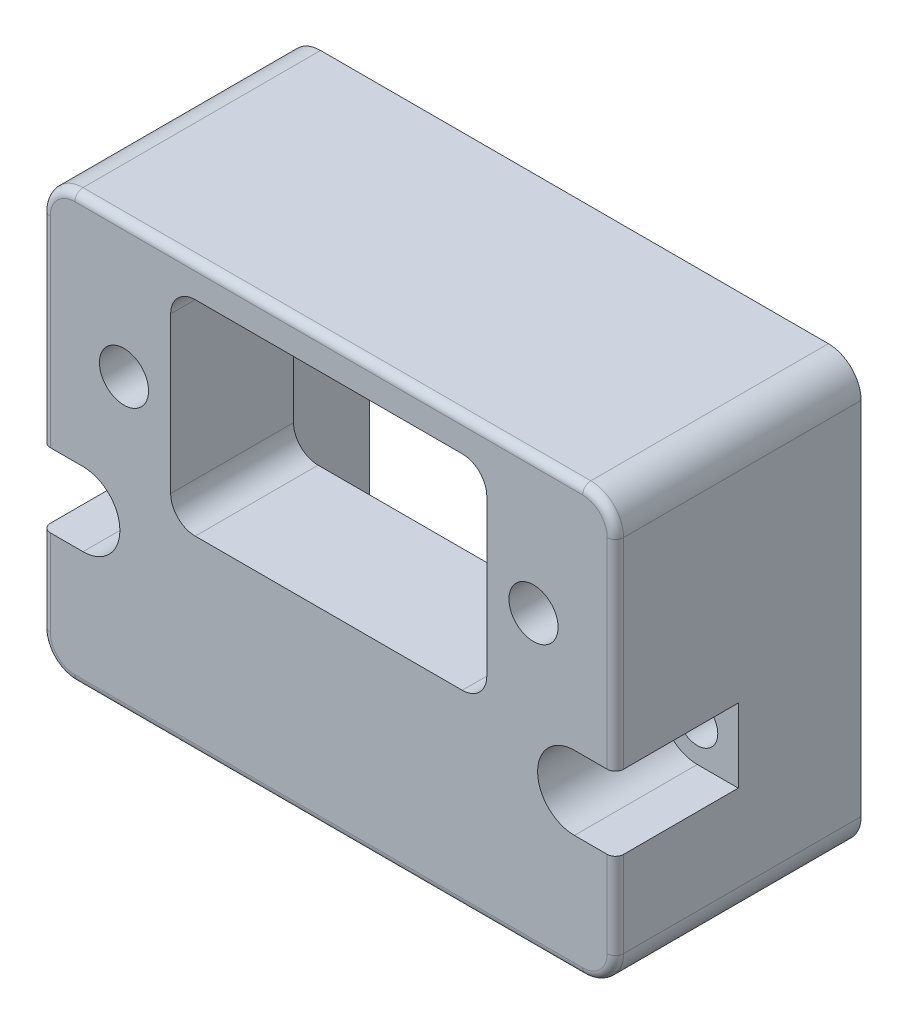
from build123d import *

# Parameters (mm, degrees)
SKETCH_1_W          = 35
SKETCH_1_H          = 26
SKETCH_1_R          = 1.25
EXTRUDE_1_DEPTH     = 15
CUT_EXTRUDE_1_DEPTH = 7.5
FILLET_1_R          = 1.5
FILLET_2_R          = 0.5
CUT_EXTRUDE_START   = -10
SKETCH_8_R          = 1.5
CUT_EXTRUDE_5_DEPTH = 10
CUT_EXTRUDE_6_DEPTH = 7.5
FILLET_3_R          = 2
SKETCH_10_R         = 4
CUT_EXTRUDE_7_DEPTH = 7.5


with BuildPart() as part:
    # Эскиз1 → Вытянуть1 (new body)
    with BuildSketch(Plane.XY):
        with Locations((17.5, 13)):
            Rectangle(SKETCH_1_W, SKETCH_1_H)
        with Locations((2.5, 9.5)):
            Circle(SKETCH_1_R, mode=Mode.SUBTRACT)
        with Locations((32.5, 9.5)):
            Circle(SKETCH_1_R, mode=Mode.SUBTRACT)
    extrude(amount=EXTRUDE_1_DEPTH)

    # Эскиз2 → Вырез-Вытянуть1 (cut)
    with BuildSketch(Plane(origin=(0, 0, 0), x_dir=(-1, 0, 0), z_dir=(0, 0, -1))):
        with BuildLine():
            Line((-30, 2), (-5, 2))
            Line((-5, 2), (-5, 16.25))
            ThreePointArc((-5, 16.25), (-3.5, 17.75), (-5, 19.25))
            Line((-5, 19.25), (-5, 24))
            Line((-5, 24), (-30, 24))
            Line((-30, 24), (-30, 19.25))
            ThreePointArc((-30, 19.25), (-31.5, 17.75), (-30, 16.25))
            Line((-30, 16.25), (-30, 2))
        make_face()
    extrude(amount=-CUT_EXTRUDE_1_DEPTH, mode=Mode.SUBTRACT)

    # Скругление1
    fillet_1_edges = [part.edges().sort_by_distance(p)[0] for p in [
        (30, 24, 3.75),
        (5, 24, 3.75),
        (5, 2, 3.75),
        (30, 2, 3.75),
    ]]
    fillet(fillet_1_edges, radius=FILLET_1_R)

    # Скругление2
    fillet_2_edges = [part.edges().sort_by_distance(p)[0] for p in [
        (17.5, 0, 15),
        (0, 13, 15),
        (35, 13, 15),
        (17.5, 26, 15),
    ]]
    fillet(fillet_2_edges, radius=FILLET_2_R)

    # Эскиз8 → Вырез-Вытянуть5 (cut)
    with BuildSketch(Plane.XY.offset(15).offset(CUT_EXTRUDE_START)):
        with Locations(Location((5, 17.75, 0), (0, 0, 180))):
            Circle(SKETCH_8_R)
        with Locations(Location((30, 17.75, 0), (0, 0, 180))):
            Circle(SKETCH_8_R)
        with BuildLine():
            Line((9.35, 11.5), (25.65, 11.5))
            ThreePointArc((25.65, 11.5), (26.710660172, 11.939339828), (27.15, 13))
            Line((27.15, 13), (27.15, 22.5))
            ThreePointArc((27.15, 22.5), (26.710660172, 23.560660172), (25.65, 24))
            Line((25.65, 24), (9.35, 24))
            ThreePointArc((9.35, 24), (8.289339828, 23.560660172), (7.85, 22.5))
            Line((7.85, 22.5), (7.85, 13))
            ThreePointArc((7.85, 13), (8.289339828, 11.939339828), (9.35, 11.5))
        make_face()
    extrude(amount=CUT_EXTRUDE_5_DEPTH, mode=Mode.SUBTRACT)

    # Эскиз9 → Вырез-Вытянуть6 (cut)
    with BuildSketch(Plane.XY.offset(15)):
        with BuildLine():
            Line((2.5, 7.25), (-1.280678269, 7.25))
            Line((-1.280678269, 7.25), (-1.280678269, 11.75))
            Line((-1.280678269, 11.75), (2.5, 11.75))
            ThreePointArc((2.5, 11.75), (4.75, 9.5), (2.5, 7.25))
        make_face()
        with BuildLine():
            Line((32.5, 7.25), (36.280678269, 7.25))
            Line((36.280678269, 7.25), (36.280678269, 11.75))
            Line((36.280678269, 11.75), (32.5, 11.75))
            ThreePointArc((32.5, 11.75), (30.25, 9.5), (32.5, 7.25))
        make_face()
    extrude(amount=-CUT_EXTRUDE_6_DEPTH, mode=Mode.SUBTRACT)

    # Скругление3
    # the kernel refuses this fillet: 2 mm, written as the material it takes off along each edge
    with BuildSketch(Plane(origin=(33, 24, 15), x_dir=(1, 0, 0), z_dir=(0, -1, 0))) as fillet_3_piece_1:
        with BuildLine():
            CenterArc((1.5, -0.5), 0.5, 0, 90)
            Line((2, -0.5), (2, 0))
            Line((2, 0), (1.5, 0))
        make_face()
    revolve(axis=Axis((33, 24, 15), (0, 0, 1)), revolution_arc=90, mode=Mode.SUBTRACT)
    with BuildSketch(Plane(origin=(2, 24, 15), x_dir=(0, 1, 0), z_dir=(1, 0, 0))) as fillet_3_piece_2:
        with BuildLine():
            CenterArc((1.5, -0.5), 0.5, 0, 90)
            Line((2, -0.5), (2, 0))
            Line((2, 0), (1.5, 0))
        make_face()
    revolve(axis=Axis((2, 24, 15), (0, 0, 1)), revolution_arc=90, mode=Mode.SUBTRACT)
    with BuildSketch(Plane(origin=(33, 2, 15), x_dir=(0, -1, 0), z_dir=(-1, 0, 0))) as fillet_3_piece_3:
        with BuildLine():
            CenterArc((1.5, -0.5), 0.5, 0, 90)
            Line((2, -0.5), (2, 0))
            Line((2, 0), (1.5, 0))
        make_face()
    revolve(axis=Axis((33, 2, 15), (0, 0, 1)), revolution_arc=90, mode=Mode.SUBTRACT)
    with BuildSketch(Plane(origin=(2, 2, 15), x_dir=(-1, 0, 0), z_dir=(0, 1, 0))) as fillet_3_piece_4:
        with BuildLine():
            CenterArc((1.5, -0.5), 0.5, 0, 90)
            Line((2, -0.5), (2, 0))
            Line((2, 0), (1.5, 0))
        make_face()
    revolve(axis=Axis((2, 2, 15), (0, 0, 1)), revolution_arc=90, mode=Mode.SUBTRACT)
    with BuildSketch(Plane(origin=(0, 0, -5), x_dir=(1, 0, 0), z_dir=(0, 0, 1)), Plane(origin=(0, 26, -5), x_dir=(0, -1, 0), z_dir=(0, 0, 1))) as fillet_3_piece_5:
        with BuildLine():
            CenterArc((FILLET_3_R, FILLET_3_R), FILLET_3_R, 180, 90)
            Line((0, FILLET_3_R), (0, 0))
            Line((0, 0), (FILLET_3_R, 0))
        make_face()
    extrude(amount=20, mode=Mode.SUBTRACT)
    with BuildSketch(Plane(origin=(35, 0, -5), x_dir=(-1, 0, 0), z_dir=(0, 0, 1)), Plane(origin=(35, 26, -5), x_dir=(0, -1, 0), z_dir=(0, 0, 1))) as fillet_3_piece_6:
        with BuildLine():
            CenterArc((FILLET_3_R, -FILLET_3_R), FILLET_3_R, 90, 90)
            Line((0, -FILLET_3_R), (0, 0))
            Line((0, 0), (FILLET_3_R, 0))
        make_face()
    extrude(amount=20, mode=Mode.SUBTRACT)

    # Эскиз10 → Вырез-Вытянуть7 (cut)
    with BuildSketch(Plane(origin=(0, 0, 0), x_dir=(-1, 0, 0), z_dir=(0, 0, -1))):
        with Locations((-5, 17.75)):
            Circle(SKETCH_10_R)
        with Locations((-30, 17.75)):
            Circle(SKETCH_10_R)
    extrude(amount=-CUT_EXTRUDE_7_DEPTH, mode=Mode.SUBTRACT)


solid = part.part
